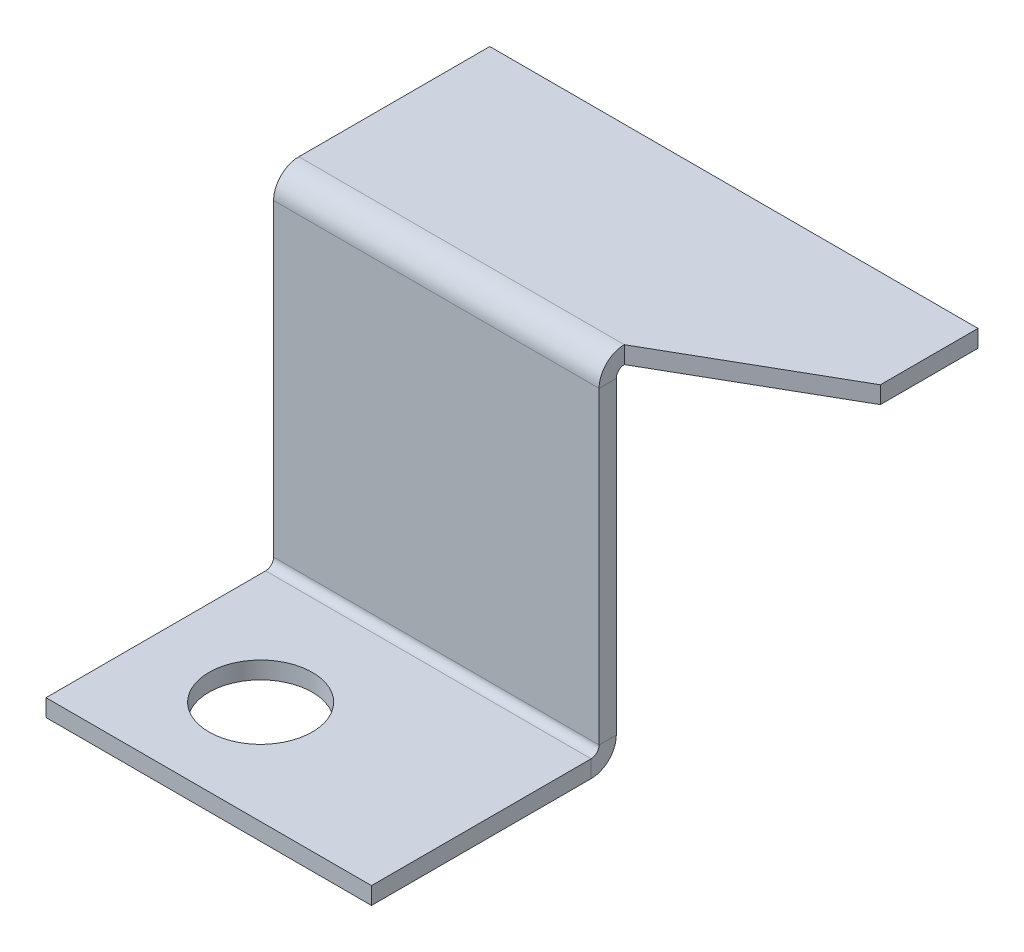
from build123d import *

# Parameters (mm, degrees)
STACK_CONNECTION_DEPTH       = 1.5875
EDGE_FLANGE1_DEPTH           = 30
EDGE_FLANGE2_STRIP_W         = 7.8232
EDGE_FLANGE2_STRIP_H         = 1.5875
EDGE_FLANGE2_STRIP_CUT_DEPTH = 30
EDGE_FLANGE2_DEPTH           = 30
SKETCH13_R                   = 4.7625
CUT_EXTRUDE1_DEPTH           = 57.330329085


# Sheet-metal steps are written as plain solids
with BuildPart() as part:
    # Sketch2 → Stack Connection (new body)
    with BuildSketch(Plane(origin=(0, 0, 0), x_dir=(1, 0, 0), z_dir=(0, 1, 0))):
        Polygon((-22.5, 0), (22.5, 0), (22.5, -9), (7.5, -17.6), (-22.5, -17.6), (-22.5, -9), align=None)
    extrude(amount=-STACK_CONNECTION_DEPTH)

    # Edge-Flange1 section (across the edge) → Edge-Flange1 (add)
    with BuildSketch(Plane(origin=(7.5, -1.5875, 18.3366), x_dir=(0, 0, -1), z_dir=(-1, 0, 0))):
        with BuildLine():
            Line((-1.5875, 0.7366), (-1.5875, 31.5259))
            Line((-1.5875, 31.5259), (0, 31.5259))
            Line((0, 31.5259), (0, 0.7366))
            ThreePointArc((0, 0.7366), (0.215745145, 0.215745145), (0.7366, 0))
            Line((0.7366, 0), (0.7366, -1.5875))
            ThreePointArc((0.7366, -1.5875), (-0.90678687, -0.90678687), (-1.5875, 0.7366))
        make_face()
    extrude(amount=EDGE_FLANGE1_DEPTH)

    # Edge-Flange2 strip (across the edge) → Edge-Flange2 strip cut (cut)
    with BuildSketch(Plane(origin=(-22.5, -33.1134, 19.9241), x_dir=(0, 1, 0), z_dir=(1, 0, 0))):
        with Locations((-1.5875, -0.79375)):
            Rectangle(EDGE_FLANGE2_STRIP_W, EDGE_FLANGE2_STRIP_H)
    extrude(amount=EDGE_FLANGE2_STRIP_CUT_DEPTH, mode=Mode.SUBTRACT)

    # Edge-Flange2 section (across the edge) → Edge-Flange2 (add)
    with BuildSketch(Plane(origin=(-22.5, -33.1134, 19.9241), x_dir=(0, 1, 0), z_dir=(1, 0, 0))):
        with BuildLine():
            Line((0, 0.7366), (0, 20.9779))
            Line((0, 20.9779), (1.5875, 20.9779))
            Line((1.5875, 20.9779), (1.5875, 0.7366))
            ThreePointArc((1.5875, 0.7366), (1.803245145, 0.215745145), (2.3241, 0))
            Line((2.3241, 0), (2.3241, -1.5875))
            ThreePointArc((2.3241, -1.5875), (0.68071313, -0.90678687), (0, 0.7366))
        make_face()
    extrude(amount=EDGE_FLANGE2_DEPTH)

    # Sketch13 → Cut-Extrude1 (cut, through all)
    with BuildSketch(Plane(origin=(0, -31.5259, 0), x_dir=(1, 0, 0), z_dir=(0, 1, 0))):
        with Locations(Location((-12.25, -31.3693, 0), (0, 0, 270))):
            Circle(SKETCH13_R)
    extrude(amount=-CUT_EXTRUDE1_DEPTH, mode=Mode.SUBTRACT)


solid = part.part
